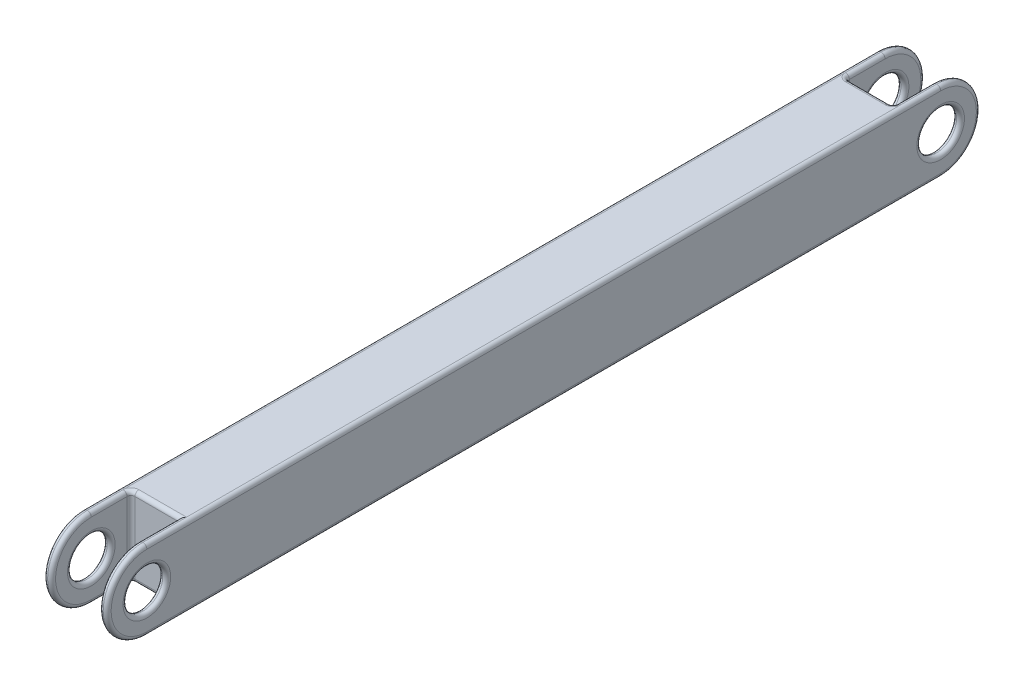
from build123d import *

# Parameters (mm, degrees)
SKETCH2_W                      = 80
SKETCH2_H                      = 100
BOSS_EXTRUDE1_DEPTH            = 450
BOSS_EXTRUDE2_DEPTH            = 10
BOSS_EXTRUDE3_DEPTH            = 10
CUT_EXTRUDE4_REACH             = 466.973
SKETCH8_R                      = 25
CUT_EXTRUDE4_DIRECTION_2_REACH = 466.973
FILLET1_R                      = 10
SKETCH10_R                     = 10
BOSS_EXTRUDE5_DEPTH            = 60
MIRROR5_START                  = -40
MIRROR5_OUTLINE_W              = 100
MIRROR5_OUTLINE_H              = 450
MIRROR5_OUTLINE_R              = 10
MIRROR5_DEPTH                  = 80
MIRROR5_2_OUTLINE_R            = 25
MIRROR5_2_OUTLINE_R_2          = 10
MIRROR5_2_DEPTH                = 10
MIRROR5_START_2                = 30
MIRROR5_3_OUTLINE_R            = 25
MIRROR5_3_OUTLINE_R_2          = 10
MIRROR5_3_DEPTH                = 10
SKETCH12_W                     = 80
SKETCH12_H                     = 60
CUT_EXTRUDE6_DEPTH             = 500
FILLET2_R                      = 5


# Read off the part's stored shape, not the designer's step: Mirror5
with BuildPart() as part:
    # Sketch2 → Boss-Extrude1 (new body)
    with BuildSketch(Plane.XY):
        Rectangle(SKETCH2_W, SKETCH2_H)
    extrude(amount=-BOSS_EXTRUDE1_DEPTH)

    # Sketch6 → Boss-Extrude2 (add)
    with BuildSketch(Plane(origin=(40, 0, 0), x_dir=(0, 0, -1), z_dir=(1, 0, 0))):
        with BuildLine():
            Line((220, -50), (280, -50))
            Line((280, -50), (280, -80))
            ThreePointArc((280, -80), (250, -110), (220, -80))
            Line((220, -80), (220, -50))
        make_face()
    boss_extrude2 = extrude(amount=-BOSS_EXTRUDE2_DEPTH)

    # Sketch7 → Boss-Extrude3 (add)
    with BuildSketch(Plane(origin=(40, 0, 0), x_dir=(0, 0, -1), z_dir=(1, 0, 0))):
        with BuildLine():
            Line((0, 50), (0, -50))
            Line((0, -50), (-50, -50))
            ThreePointArc((-50, -50), (-100, 0), (-50, 50))
            Line((-50, 50), (0, 50))
        make_face()
    boss_extrude3 = extrude(amount=-BOSS_EXTRUDE3_DEPTH)

    # Mirror3: Boss-Extrude3 across plane
    add(boss_extrude3.mirror(Plane(origin=(0, 0, 0), x_dir=(0, 0, 1), z_dir=(1, 0, 0))))

    # Cut-Extrude4: up to this face of the body (flat: up to its plane)
    cut_extrude4_end = Plane(part.part.faces().sort_by_distance((-40, 0, -180.249574073))[0])
    # Sketch8 → Cut-Extrude4 (cut, up to the picked face)
    with BuildSketch(Plane(origin=(0, 0, 0), x_dir=(0, 0, -1), z_dir=(1, 0, 0)), mode=Mode.PRIVATE) as cut_extrude4_sk1:
        with Locations(Location((-50, 0, 0), (0, 0, 270))):
            Circle(SKETCH8_R)
    cut_extrude4_tool1 = split(extrude(cut_extrude4_sk1.sketch, amount=-CUT_EXTRUDE4_REACH, mode=Mode.PRIVATE), bisect_by=cut_extrude4_end, keep=Keep.BOTH, mode=Mode.PRIVATE)
    add(cut_extrude4_tool1.solids().sort_by(Axis((0, 0, 50), (-1, 0, 0)))[0], mode=Mode.SUBTRACT)

    # Cut-Extrude4 direction 2: up to this face of the body (flat: up to its plane)
    cut_extrude4_direction_2_end = Plane(part.part.faces().sort_by_distance((40, -4.341866707, -184.172488542))[0])
    # Sketch8 → Cut-Extrude4 direction 2 (cut, up to the picked face)
    with BuildSketch(Plane(origin=(0, 0, 0), x_dir=(0, 0, -1), z_dir=(1, 0, 0)), mode=Mode.PRIVATE) as cut_extrude4_direction_2_sk1:
        with Locations(Location((-50, 0, 0), (0, 0, 270))):
            Circle(SKETCH8_R)
    cut_extrude4_direction_2_tool1 = split(extrude(cut_extrude4_direction_2_sk1.sketch, amount=CUT_EXTRUDE4_DIRECTION_2_REACH, mode=Mode.PRIVATE), bisect_by=cut_extrude4_direction_2_end, keep=Keep.BOTH, mode=Mode.PRIVATE)
    add(cut_extrude4_direction_2_tool1.solids().sort_by(Axis((0, 0, 50), (1, 0, 0)))[0], mode=Mode.SUBTRACT)

    # Mirror4: Boss-Extrude2 across plane
    add(boss_extrude2.mirror(Plane(origin=(0, 0, 0), x_dir=(0, 0, 1), z_dir=(1, 0, 0))))

    # Fillet1
    fillet1_edges = [part.edges().sort_by_distance(p)[0] for p in [
        (-35, -50, -280),
        (35, -50, -280),
        (-35, -50, -220),
        (35, -50, -220),
    ]]
    fillet(fillet1_edges, radius=FILLET1_R)

    # Sketch10 → Boss-Extrude5 (add)
    with BuildSketch(Plane.ZY.offset(-30)):
        with Locations(Location((-250, -80, 0), (0, 0, 90))):
            Circle(SKETCH10_R)
    extrude(amount=BOSS_EXTRUDE5_DEPTH)

    # Mirror5 outline → Mirror5 (add)
    with BuildSketch(Plane.YZ.offset(MIRROR5_START)):
        with Locations((0, -675)):
            Rectangle(MIRROR5_OUTLINE_W, MIRROR5_OUTLINE_H)
        with Locations((-80, -650)):
            Circle(MIRROR5_OUTLINE_R)
    extrude(amount=MIRROR5_DEPTH)

    # Mirror5 2 outline → Mirror5 2 (add)
    # profile 1 of 2: a face of its own
    with BuildSketch(Plane.YZ.offset(MIRROR5_START)):
        with BuildLine():
            Line((50, -900), (-50, -900))
            Line((-50, -900), (-50, -950))
            ThreePointArc((-50, -950), (0, -1000), (50, -950))
            Line((50, -950), (50, -900))
        make_face()
        with Locations((0, -950)):
            Circle(MIRROR5_2_OUTLINE_R, mode=Mode.SUBTRACT)
    # profile 2 of 2: a face of its own
    with BuildSketch(Plane.YZ.offset(MIRROR5_START)):
        with BuildLine():
            ThreePointArc((-60, -680), (-52.928932188, -682.928932188), (-50, -690))
            Line((-50, -690), (-50, -610))
            ThreePointArc((-50, -610), (-52.928932188, -617.071067812), (-60, -620))
            Line((-60, -620), (-80, -620))
            ThreePointArc((-80, -620), (-110, -650), (-80, -680))
            Line((-80, -680), (-60, -680))
        make_face()
        with Locations((-80, -650)):
            Circle(MIRROR5_2_OUTLINE_R_2, mode=Mode.SUBTRACT)
    extrude(amount=MIRROR5_2_DEPTH)

    # Mirror5 3 outline → Mirror5 3 (add)
    # profile 1 of 2: a face of its own
    with BuildSketch(Plane.YZ.offset(MIRROR5_START_2)):
        with BuildLine():
            Line((50, -900), (-50, -900))
            Line((-50, -900), (-50, -950))
            ThreePointArc((-50, -950), (0, -1000), (50, -950))
            Line((50, -950), (50, -900))
        make_face()
        with Locations((0, -950)):
            Circle(MIRROR5_3_OUTLINE_R, mode=Mode.SUBTRACT)
    # profile 2 of 2: a face of its own
    with BuildSketch(Plane.YZ.offset(MIRROR5_START_2)):
        with BuildLine():
            ThreePointArc((-60, -680), (-52.928932188, -682.928932188), (-50, -690))
            Line((-50, -690), (-50, -610))
            ThreePointArc((-50, -610), (-52.928932188, -617.071067812), (-60, -620))
            Line((-60, -620), (-80, -620))
            ThreePointArc((-80, -620), (-110, -650), (-80, -680))
            Line((-80, -680), (-60, -680))
        make_face()
        with Locations((-80, -650)):
            Circle(MIRROR5_3_OUTLINE_R_2, mode=Mode.SUBTRACT)
    extrude(amount=MIRROR5_3_DEPTH)

    # Sketch12 → Cut-Extrude6 (cut, symmetric)
    with BuildSketch(Plane(origin=(0, 0, -450), x_dir=(-1, 0, 0), z_dir=(0, 0, -1))):
        with Locations((0, -80)):
            Rectangle(SKETCH12_W, SKETCH12_H)
    extrude(amount=CUT_EXTRUDE6_DEPTH, both=True, mode=Mode.SUBTRACT)

    # Fillet2
    fillet2_edges = [part.edges().sort_by_distance(p)[0] for p in [
        (0, -50, 0),
        (30, 50, -925),
        (30, -50, -925),
        (30, -50, 25),
        (-40, -50, -450),
        (40, -25, -950),
        (30, -25, -950),
        (-40, -25, -950),
        (-30, -25, -950),
        (-40, 0, -1000),
        (-30, 0, -1000),
        (-30, 50, -925),
        (-30, -50, -925),
        (-30, 0, -900),
        (40, 0, -1000),
        (30, 0, -1000),
        (30, 0, -900),
        (0, -50, -900),
        (0, 50, -900),
        (40, 25, 50),
        (-40, 25, 50),
        (-30, 25, 50),
        (30, 25, 50),
        (-40, 0, 100),
        (-30, 0, 100),
        (-30, 50, 25),
        (-30, -50, 25),
        (-30, 0, 0),
        (40, 0, 100),
        (30, 0, 100),
        (30, 50, 25),
        (0, 50, 0),
        (40, 50, -450),
        (-40, 50, -450),
        (40, -50, -450),
    ]]
    fillet(fillet2_edges, radius=FILLET2_R - 0.0001)  # a hair under: the kernel refuses the full size


solid = part.part
